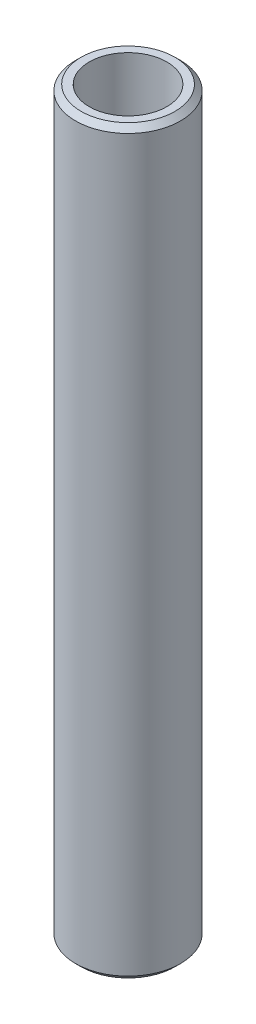
from build123d import *

# Parameters (mm, degrees)
SKETCH1_R           = 42.5
BOSS_EXTRUDE1_DEPTH = 600
SKETCH2_R           = 31.437770198
CUT_EXTRUDE1_DEPTH  = 604.002902149
CHAMFER1_SIZE       = 4.468576386


with BuildPart() as part:
    # Sketch1 → Boss-Extrude1 (new body)
    with BuildSketch(Plane(origin=(0, 0, 0), x_dir=(1, 0, 0), z_dir=(0, 1, 0))):
        Circle(SKETCH1_R)
    extrude(amount=BOSS_EXTRUDE1_DEPTH)

    # Sketch2 → Cut-Extrude1 (cut, through all)
    with BuildSketch(Plane(origin=(0, 0, 0), x_dir=(1, 0, 0), z_dir=(0, 1, 0))):
        Circle(SKETCH2_R)
    extrude(amount=CUT_EXTRUDE1_DEPTH, mode=Mode.SUBTRACT)

    # Chamfer1
    chamfer1_edges = [part.edges().sort_by_distance(p)[0] for p in [
        (-42.5, 600, 0),
        (-42.5, 0, 0),
    ]]
    chamfer(chamfer1_edges, length=CHAMFER1_SIZE)


solid = part.part
